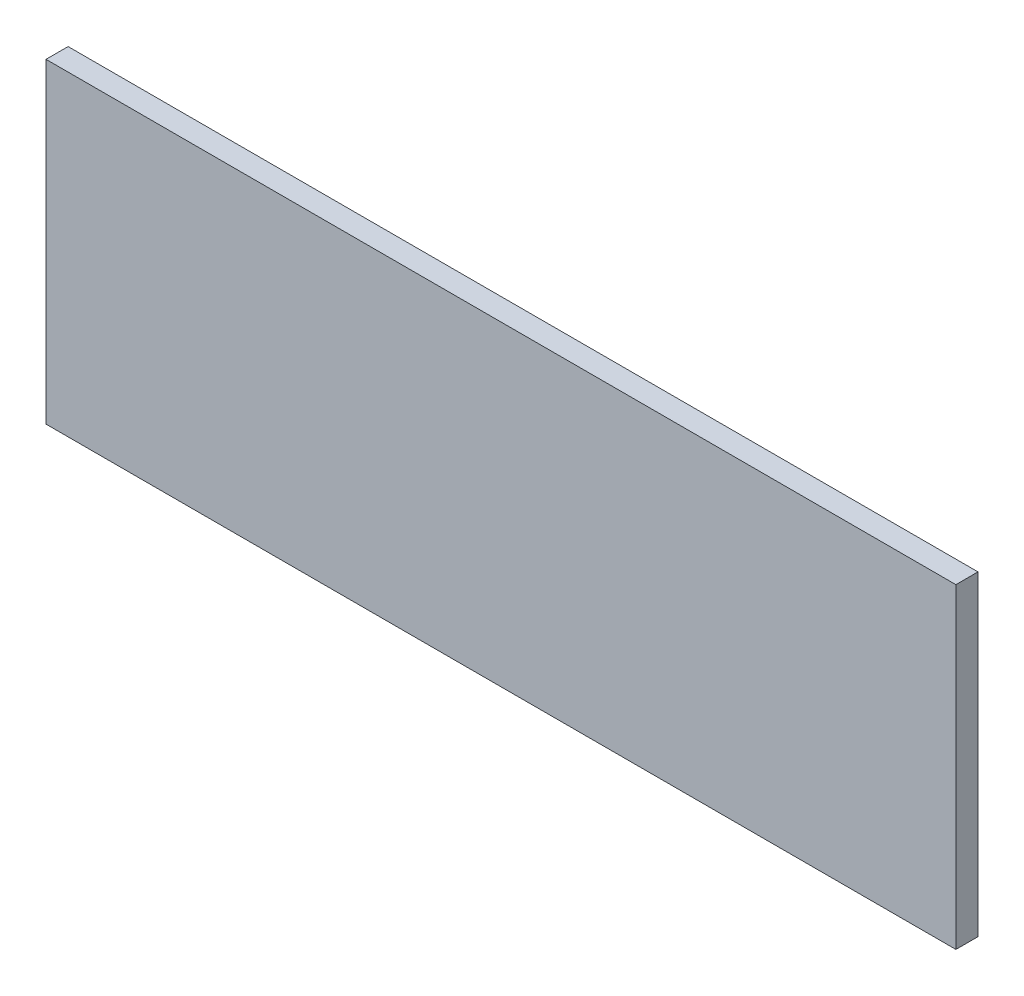
from build123d import *

# Parameters (mm, degrees)
SKETCH1_W           = 1828.8
SKETCH1_H           = 635
BOSS_EXTRUDE1_DEPTH = 44.45


with BuildPart() as part:
    # Sketch1 → Boss-Extrude1 (new body)
    with BuildSketch(Plane.XY):
        Rectangle(SKETCH1_W, SKETCH1_H)
    extrude(amount=-BOSS_EXTRUDE1_DEPTH)


solid = part.part
